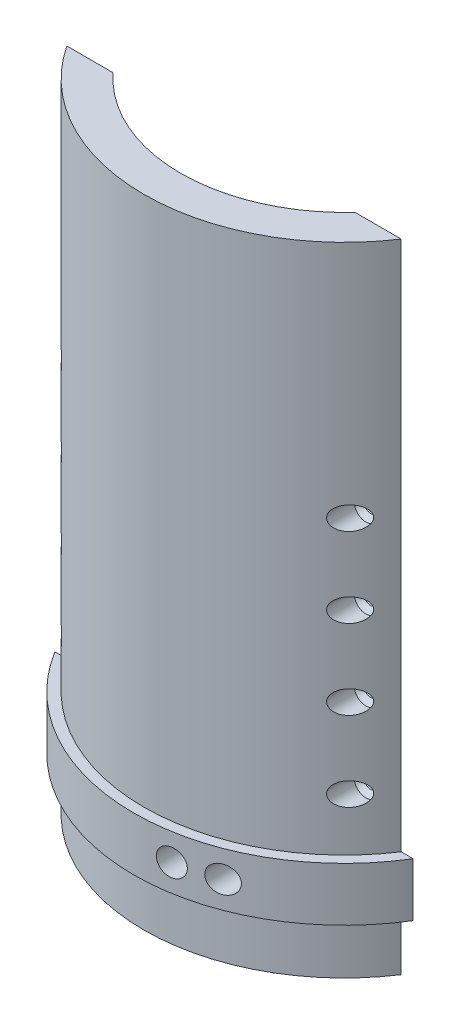
from build123d import *

# Parameters (mm, degrees)
BOSS_EXTRUDE1_DEPTH      = 120
LPATTERN1_COUNT          = 5
LPATTERN1_PITCH          = 20
BOSS_EXTRUDE2_DEPTH      = 6.731
BOSS_EXTRUDE2_DEPTH_BACK = 6.731
SKETCH9_R                = 3.334469726
CUT_EXTRUDE1_DEPTH       = 34
BOSS_EXTRUDE3_DEPTH      = 40


with BuildPart() as part:
    # Sketch1 → Boss-Extrude1 (new body)
    with BuildSketch(Plane(origin=(60.535204745, 0, -85.948449604), x_dir=(1, 0, 0), z_dir=(0, 1, 0))):
        with BuildLine():
            ThreePointArc((-30.186446753, -113.644462538), (-60.535204745, -127.035141416), (-90.883962736, -113.644462538))
            Line((-90.883962736, -113.644462538), (-102.513962844, -113.644462538))
            ThreePointArc((-102.513962844, -113.644462538), (-60.535204745, -136.240449604), (-18.556446645, -113.644462538))
            Line((-18.556446645, -113.644462538), (-30.186446753, -113.644462538))
        make_face()
    extrude(amount=BOSS_EXTRUDE1_DEPTH)

    # Sketch6 → Cut-Revolve4 (revolve, cut)
    with BuildSketch(Plane(origin=(36.163758045, 20, 27.696012934), x_dir=(-1, 0, 0), z_dir=(0, -1, 0))):
        Polygon((0, 1.685394277), (0, -4.78184701), (0, -15.185924704), (-2.9, -15.185924704), (-2.9, -3.079025683), (-1.65, -1.881964943), (-1.65, 1.685394277), align=None)
    cut_revolve4 = revolve(axis=Axis((36.163758045, 20, 26.010618657), (0, 0, 1)), mode=Mode.SUBTRACT)

    # LPattern1: Cut-Revolve4 ×5
    with Locations(*[(0, i * LPATTERN1_PITCH, 0) for i in range(1, LPATTERN1_COUNT)]):
        add(cut_revolve4, mode=Mode.SUBTRACT)

    # Mirror1: Cut-Revolve4 across plane
    add(cut_revolve4.mirror(Plane(origin=(0, 0, 0), x_dir=(0, 0, 1), z_dir=(1, 0, 0))), mode=Mode.SUBTRACT)

    # Mirror1 copy 1 sketch → Mirror1 copy 1 (revolve, cut)
    with BuildSketch(Plane(origin=(-36.163758045, 40, 27.696012934), x_dir=(1, 0, 0), z_dir=(0, -1, 0))):
        Polygon((0, -1.685394277), (0, 4.78184701), (0, 15.185924704), (-2.9, 15.185924704), (-2.9, 3.079025683), (-1.65, 1.881964943), (-1.65, -1.685394277), align=None)
    revolve(axis=Axis((-36.163758045, 40, 26.010618657), (0, 0, -1)), mode=Mode.SUBTRACT)

    # Mirror1 copy 2 sketch → Mirror1 copy 2 (revolve, cut)
    with BuildSketch(Plane(origin=(-36.163758045, 60, 27.696012934), x_dir=(1, 0, 0), z_dir=(0, -1, 0))):
        Polygon((0, -1.685394277), (0, 4.78184701), (0, 15.185924704), (-2.9, 15.185924704), (-2.9, 3.079025683), (-1.65, 1.881964943), (-1.65, -1.685394277), align=None)
    revolve(axis=Axis((-36.163758045, 60, 26.010618657), (0, 0, -1)), mode=Mode.SUBTRACT)

    # Mirror1 copy 3 sketch → Mirror1 copy 3 (revolve, cut)
    with BuildSketch(Plane(origin=(-36.163758045, 80, 27.696012934), x_dir=(1, 0, 0), z_dir=(0, -1, 0))):
        Polygon((0, -1.685394277), (0, 4.78184701), (0, 15.185924704), (-2.9, 15.185924704), (-2.9, 3.079025683), (-1.65, 1.881964943), (-1.65, -1.685394277), align=None)
    revolve(axis=Axis((-36.163758045, 80, 26.010618657), (0, 0, -1)), mode=Mode.SUBTRACT)

    # Mirror1 copy 4 sketch → Mirror1 copy 4 (revolve, cut)
    with BuildSketch(Plane(origin=(-36.163758045, 100, 27.696012934), x_dir=(1, 0, 0), z_dir=(0, -1, 0))):
        Polygon((0, -1.685394277), (0, 4.78184701), (0, 15.185924704), (-2.9, 15.185924704), (-2.9, 3.079025683), (-1.65, 1.881964943), (-1.65, -1.685394277), align=None)
    revolve(axis=Axis((-36.163758045, 100, 26.010618657), (0, 0, -1)), mode=Mode.SUBTRACT)

    # Sketch7 → Boss-Extrude2 (add, two sides: drawn at the far end of the back side and taken through both)
    with BuildSketch(Plane(origin=(0, 20, 0), x_dir=(-1, 0, 0), z_dir=(0, -1, 0)).offset(-BOSS_EXTRUDE2_DEPTH_BACK)):
        with BuildLine():
            Line((-44.990566695, -27.696012934), (-41.978758099, -27.696012934))
            ThreePointArc((-41.978758099, -27.696012934), (0, -50.292), (41.978758099, -27.696012934))
            Line((41.978758099, -27.696012934), (44.990566695, -27.696012934))
            ThreePointArc((44.990566695, -27.696012934), (0, -52.832), (-44.990566695, -27.696012934))
        make_face()
    extrude(amount=BOSS_EXTRUDE2_DEPTH + BOSS_EXTRUDE2_DEPTH_BACK)

    # Sketch9 → Cut-Extrude1 (cut)
    with BuildSketch(Plane(origin=(0, 0, 27.696012934), x_dir=(-1, 0, 0), z_dir=(0, 0, -1))):
        with Locations((-18.801989508, 20)):
            Circle(SKETCH9_R)
        with Locations((-8.69556827, 20)):
            Circle(SKETCH9_R)
    extrude(amount=-CUT_EXTRUDE1_DEPTH, mode=Mode.SUBTRACT)

    # Sketch10 → Boss-Extrude3 (add)
    with BuildSketch(Plane(origin=(0, 120, 0), x_dir=(1, 0, 0), z_dir=(0, 1, 0))):
        with BuildLine():
            Line((-30.348757991, -27.696012934), (-41.978758099, -27.696012934))
            ThreePointArc((-41.978758099, -27.696012934), (0, -50.292), (41.978758099, -27.696012934))
            Line((41.978758099, -27.696012934), (30.348757991, -27.696012934))
            ThreePointArc((30.348757991, -27.696012934), (0, -41.086691812), (-30.348757991, -27.696012934))
        make_face()
    extrude(amount=BOSS_EXTRUDE3_DEPTH)


solid = part.part
